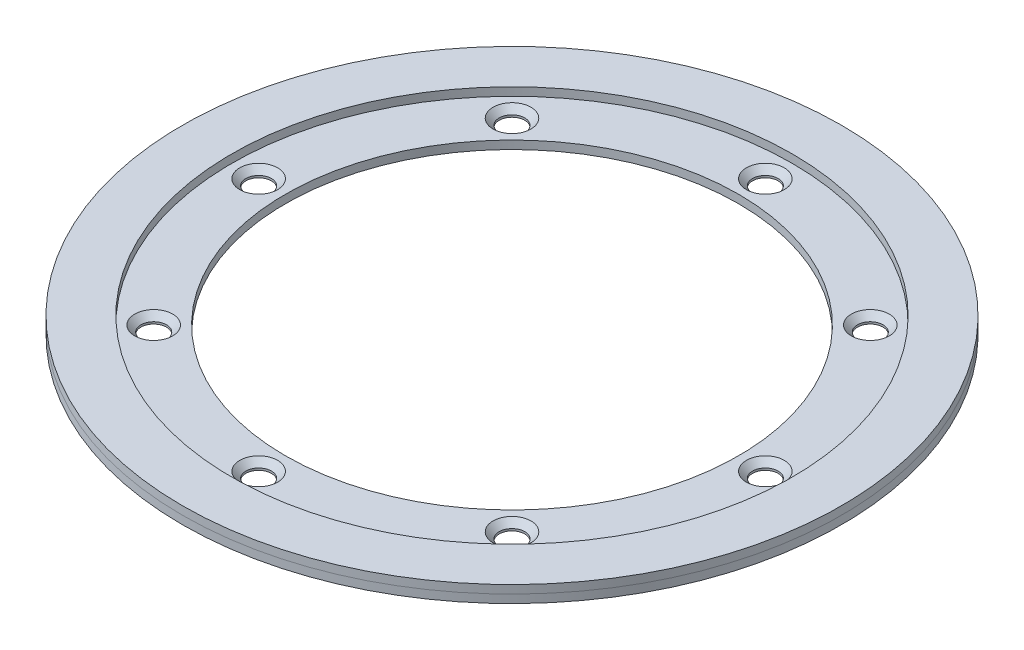
from build123d import *

# Parameters (mm, degrees)
CIRPATTERN1_COUNT = 8


with BuildPart() as part:
    # Sketch1 → Revolve1 (revolve)
    with BuildSketch(Plane.XY):
        Polygon((-40, 0), (-27.5, 0), (-27.5, 1), (-34, 1), (-34, 2), (-40, 2), align=None)
    revolve(axis=Axis((0, 0, 0), (0, 1, 0)))

    # Sketch2 → CSK for M2.5 Countersunk Flat Head Screw1 (revolve, cut)
    with BuildSketch(Plane(origin=(0, 1, -30.75), x_dir=(0, 0, 1), z_dir=(1, 0, 0))):
        Polygon((0, 0), (0, 1), (1.55, 1), (1.55, 0.75), (2.3, 0), align=None)
    csk_for_m2_5_countersunk_flat_head_screw = revolve(axis=Axis((0, 7.35, -30.75), (0, -1, 0)), mode=Mode.SUBTRACT)

    # CirPattern1: CSK for M2.5 Countersunk Flat Head Screw1 ×8 about axis
    cirpattern1_axis = Axis((0, 1, 0), (0, -1, 0))
    for i in range(1, CIRPATTERN1_COUNT):
        add(csk_for_m2_5_countersunk_flat_head_screw.rotate(cirpattern1_axis, i * 360 / CIRPATTERN1_COUNT), mode=Mode.SUBTRACT)


with BuildPart() as body_2:
    # Split1: the piece on the far side of the plane
    add(part.part)
    split(bisect_by=Plane(origin=(-34, 1, 0), x_dir=(0, 0, -1), z_dir=(0, -1, 0)), keep=Keep.BOTTOM)


with BuildPart() as part_1:
    add(part.part)

    # Split1
    split(bisect_by=Plane(origin=(-34, 1, 0), x_dir=(0, 0, -1), z_dir=(0, -1, 0)), keep=Keep.TOP)


solid = Compound([body_2.part, part_1.part])
